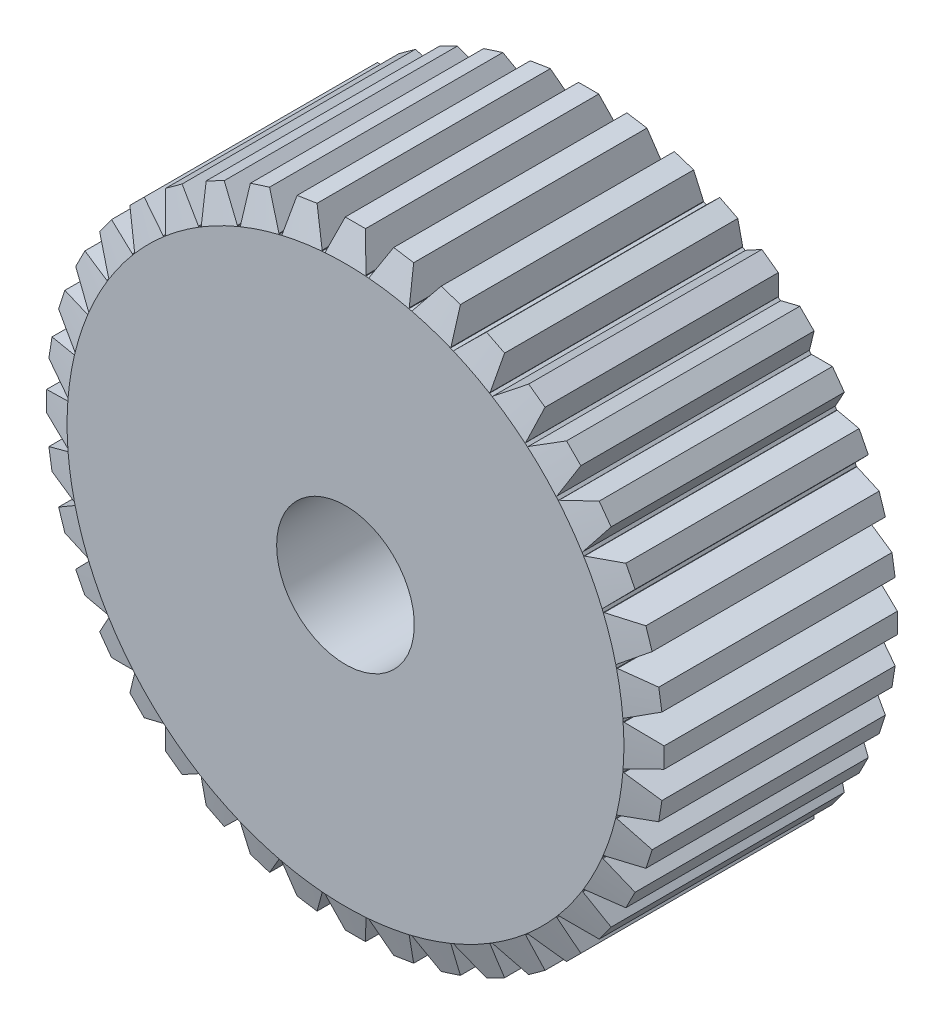
from build123d import *

# Parameters (mm, degrees)
SKETCH1_R             = 6.985
BOSS_EXTRUDE1_DEPTH   = 6.35
BOSS_EXTRUDE4_DEPTH   = 6.35
CIRPATTERN2_COUNT     = 40
SKETCH5_R             = 4.318
CUT_EXTRUDE1_DEPTH    = 1.778
F_8_32_TAPPED_HOLE1_D = 3.4544


with BuildPart() as part:
    # Sketch1 → Boss-Extrude1 (new body)
    with BuildSketch(Plane.XY):
        Circle(SKETCH1_R)
    extrude(amount=-BOSS_EXTRUDE1_DEPTH)


with BuildPart() as body_2:
    # Sketch2 → Boss-Extrude4 (new, through all)
    with BuildSketch(Plane.XY):
        Polygon((-0.508, 6.985), (-0.254, 7.747), (0, 7.747), (0.254, 7.747), (0.508, 6.985), (0.508, 6.731), (-0.508, 6.731), align=None)
    extrude(amount=-BOSS_EXTRUDE4_DEPTH)


with BuildPart() as cirpattern2_1:
    # CirPattern2: pattern copy
    add(body_2.part.rotate(Axis((0, 0, 0), (0, 0, 1)), 1 * 360 / CIRPATTERN2_COUNT))


with BuildPart() as cirpattern2_2:
    # CirPattern2: pattern copy
    add(body_2.part.rotate(Axis((0, 0, 0), (0, 0, 1)), 2 * 360 / CIRPATTERN2_COUNT))


with BuildPart() as cirpattern2_3:
    # CirPattern2: pattern copy
    add(body_2.part.rotate(Axis((0, 0, 0), (0, 0, 1)), 3 * 360 / CIRPATTERN2_COUNT))


with BuildPart() as cirpattern2_4:
    # CirPattern2: pattern copy
    add(body_2.part.rotate(Axis((0, 0, 0), (0, 0, 1)), 4 * 360 / CIRPATTERN2_COUNT))


with BuildPart() as cirpattern2_5:
    # CirPattern2: pattern copy
    add(body_2.part.rotate(Axis((0, 0, 0), (0, 0, 1)), 5 * 360 / CIRPATTERN2_COUNT))


with BuildPart() as cirpattern2_6:
    # CirPattern2: pattern copy
    add(body_2.part.rotate(Axis((0, 0, 0), (0, 0, 1)), 6 * 360 / CIRPATTERN2_COUNT))


with BuildPart() as cirpattern2_7:
    # CirPattern2: pattern copy
    add(body_2.part.rotate(Axis((0, 0, 0), (0, 0, 1)), 7 * 360 / CIRPATTERN2_COUNT))


with BuildPart() as cirpattern2_8:
    # CirPattern2: pattern copy
    add(body_2.part.rotate(Axis((0, 0, 0), (0, 0, 1)), 8 * 360 / CIRPATTERN2_COUNT))


with BuildPart() as cirpattern2_9:
    # CirPattern2: pattern copy
    add(body_2.part.rotate(Axis((0, 0, 0), (0, 0, 1)), 9 * 360 / CIRPATTERN2_COUNT))


with BuildPart() as cirpattern2_10:
    # CirPattern2: pattern copy
    add(body_2.part.rotate(Axis((0, 0, 0), (0, 0, 1)), 10 * 360 / CIRPATTERN2_COUNT))


with BuildPart() as cirpattern2_11:
    # CirPattern2: pattern copy
    add(body_2.part.rotate(Axis((0, 0, 0), (0, 0, 1)), 11 * 360 / CIRPATTERN2_COUNT))


with BuildPart() as cirpattern2_12:
    # CirPattern2: pattern copy
    add(body_2.part.rotate(Axis((0, 0, 0), (0, 0, 1)), 12 * 360 / CIRPATTERN2_COUNT))


with BuildPart() as cirpattern2_13:
    # CirPattern2: pattern copy
    add(body_2.part.rotate(Axis((0, 0, 0), (0, 0, 1)), 13 * 360 / CIRPATTERN2_COUNT))


with BuildPart() as cirpattern2_14:
    # CirPattern2: pattern copy
    add(body_2.part.rotate(Axis((0, 0, 0), (0, 0, 1)), 14 * 360 / CIRPATTERN2_COUNT))


with BuildPart() as cirpattern2_15:
    # CirPattern2: pattern copy
    add(body_2.part.rotate(Axis((0, 0, 0), (0, 0, 1)), 15 * 360 / CIRPATTERN2_COUNT))


with BuildPart() as cirpattern2_16:
    # CirPattern2: pattern copy
    add(body_2.part.rotate(Axis((0, 0, 0), (0, 0, 1)), 16 * 360 / CIRPATTERN2_COUNT))


with BuildPart() as cirpattern2_17:
    # CirPattern2: pattern copy
    add(body_2.part.rotate(Axis((0, 0, 0), (0, 0, 1)), 17 * 360 / CIRPATTERN2_COUNT))


with BuildPart() as cirpattern2_18:
    # CirPattern2: pattern copy
    add(body_2.part.rotate(Axis((0, 0, 0), (0, 0, 1)), 18 * 360 / CIRPATTERN2_COUNT))


with BuildPart() as cirpattern2_19:
    # CirPattern2: pattern copy
    add(body_2.part.rotate(Axis((0, 0, 0), (0, 0, 1)), 19 * 360 / CIRPATTERN2_COUNT))


with BuildPart() as cirpattern2_20:
    # CirPattern2: pattern copy
    add(body_2.part.rotate(Axis((0, 0, 0), (0, 0, 1)), 20 * 360 / CIRPATTERN2_COUNT))


with BuildPart() as cirpattern2_21:
    # CirPattern2: pattern copy
    add(body_2.part.rotate(Axis((0, 0, 0), (0, 0, 1)), 21 * 360 / CIRPATTERN2_COUNT))


with BuildPart() as cirpattern2_22:
    # CirPattern2: pattern copy
    add(body_2.part.rotate(Axis((0, 0, 0), (0, 0, 1)), 22 * 360 / CIRPATTERN2_COUNT))


with BuildPart() as cirpattern2_23:
    # CirPattern2: pattern copy
    add(body_2.part.rotate(Axis((0, 0, 0), (0, 0, 1)), 23 * 360 / CIRPATTERN2_COUNT))


with BuildPart() as cirpattern2_24:
    # CirPattern2: pattern copy
    add(body_2.part.rotate(Axis((0, 0, 0), (0, 0, 1)), 24 * 360 / CIRPATTERN2_COUNT))


with BuildPart() as cirpattern2_25:
    # CirPattern2: pattern copy
    add(body_2.part.rotate(Axis((0, 0, 0), (0, 0, 1)), 25 * 360 / CIRPATTERN2_COUNT))


with BuildPart() as cirpattern2_26:
    # CirPattern2: pattern copy
    add(body_2.part.rotate(Axis((0, 0, 0), (0, 0, 1)), 26 * 360 / CIRPATTERN2_COUNT))


with BuildPart() as cirpattern2_27:
    # CirPattern2: pattern copy
    add(body_2.part.rotate(Axis((0, 0, 0), (0, 0, 1)), 27 * 360 / CIRPATTERN2_COUNT))


with BuildPart() as cirpattern2_28:
    # CirPattern2: pattern copy
    add(body_2.part.rotate(Axis((0, 0, 0), (0, 0, 1)), 28 * 360 / CIRPATTERN2_COUNT))


with BuildPart() as cirpattern2_29:
    # CirPattern2: pattern copy
    add(body_2.part.rotate(Axis((0, 0, 0), (0, 0, 1)), 29 * 360 / CIRPATTERN2_COUNT))


with BuildPart() as cirpattern2_30:
    # CirPattern2: pattern copy
    add(body_2.part.rotate(Axis((0, 0, 0), (0, 0, 1)), 30 * 360 / CIRPATTERN2_COUNT))


with BuildPart() as cirpattern2_31:
    # CirPattern2: pattern copy
    add(body_2.part.rotate(Axis((0, 0, 0), (0, 0, 1)), 31 * 360 / CIRPATTERN2_COUNT))


with BuildPart() as cirpattern2_32:
    # CirPattern2: pattern copy
    add(body_2.part.rotate(Axis((0, 0, 0), (0, 0, 1)), 32 * 360 / CIRPATTERN2_COUNT))


with BuildPart() as cirpattern2_33:
    # CirPattern2: pattern copy
    add(body_2.part.rotate(Axis((0, 0, 0), (0, 0, 1)), 33 * 360 / CIRPATTERN2_COUNT))


with BuildPart() as cirpattern2_34:
    # CirPattern2: pattern copy
    add(body_2.part.rotate(Axis((0, 0, 0), (0, 0, 1)), 34 * 360 / CIRPATTERN2_COUNT))


with BuildPart() as cirpattern2_35:
    # CirPattern2: pattern copy
    add(body_2.part.rotate(Axis((0, 0, 0), (0, 0, 1)), 35 * 360 / CIRPATTERN2_COUNT))


with BuildPart() as cirpattern2_36:
    # CirPattern2: pattern copy
    add(body_2.part.rotate(Axis((0, 0, 0), (0, 0, 1)), 36 * 360 / CIRPATTERN2_COUNT))


with BuildPart() as cirpattern2_37:
    # CirPattern2: pattern copy
    add(body_2.part.rotate(Axis((0, 0, 0), (0, 0, 1)), 37 * 360 / CIRPATTERN2_COUNT))


with BuildPart() as cirpattern2_38:
    # CirPattern2: pattern copy
    add(body_2.part.rotate(Axis((0, 0, 0), (0, 0, 1)), 38 * 360 / CIRPATTERN2_COUNT))


with BuildPart() as cirpattern2_39:
    # CirPattern2: pattern copy
    add(body_2.part.rotate(Axis((0, 0, 0), (0, 0, 1)), 39 * 360 / CIRPATTERN2_COUNT))


with BuildPart() as part_1:
    add(part.part)

    # Combine2: union body 2, CirPattern2_1, CirPattern2_2, CirPattern2_3, CirPattern2_4, CirPattern2_5, CirPattern2_6, CirPattern2_7, CirPattern2_8, CirPattern2_9, CirPattern2_10, CirPattern2_11, CirPattern2_12, CirPattern2_13, CirPattern2_14, CirPattern2_15, CirPattern2_16, CirPattern2_17, CirPattern2_18, CirPattern2_19, CirPattern2_20, CirPattern2_21, CirPattern2_22, CirPattern2_23, CirPattern2_24, CirPattern2_25, CirPattern2_26, CirPattern2_27, CirPattern2_28, CirPattern2_29, CirPattern2_30, CirPattern2_31, CirPattern2_32, CirPattern2_33, CirPattern2_34, CirPattern2_35, CirPattern2_36, CirPattern2_37, CirPattern2_38, CirPattern2_39
    add(body_2.part)
    add(cirpattern2_1.part)
    add(cirpattern2_2.part)
    add(cirpattern2_3.part)
    add(cirpattern2_4.part)
    add(cirpattern2_5.part)
    add(cirpattern2_6.part)
    add(cirpattern2_7.part)
    add(cirpattern2_8.part)
    add(cirpattern2_9.part)
    add(cirpattern2_10.part)
    add(cirpattern2_11.part)
    add(cirpattern2_12.part)
    add(cirpattern2_13.part)
    add(cirpattern2_14.part)
    add(cirpattern2_15.part)
    add(cirpattern2_16.part)
    add(cirpattern2_17.part)
    add(cirpattern2_18.part)
    add(cirpattern2_19.part)
    add(cirpattern2_20.part)
    add(cirpattern2_21.part)
    add(cirpattern2_22.part)
    add(cirpattern2_23.part)
    add(cirpattern2_24.part)
    add(cirpattern2_25.part)
    add(cirpattern2_26.part)
    add(cirpattern2_27.part)
    add(cirpattern2_28.part)
    add(cirpattern2_29.part)
    add(cirpattern2_30.part)
    add(cirpattern2_31.part)
    add(cirpattern2_32.part)
    add(cirpattern2_33.part)
    add(cirpattern2_34.part)
    add(cirpattern2_35.part)
    add(cirpattern2_36.part)
    add(cirpattern2_37.part)
    add(cirpattern2_38.part)
    add(cirpattern2_39.part)

    # Sketch5 → Cut-Extrude1 (cut)
    with BuildSketch(Plane(origin=(0, 0, -6.35), x_dir=(-1, 0, 0), z_dir=(0, 0, -1))):
        Circle(SKETCH5_R)
    extrude(amount=-CUT_EXTRUDE1_DEPTH, mode=Mode.SUBTRACT)

    # Sketch4 → Cut-Revolve3 (revolve, cut)
    with BuildSketch(Plane(origin=(0, 0, 0), x_dir=(0, 0, -1), z_dir=(1, 0, 0))):
        Polygon((6.096, 7.766731618), (6.096, 8.001), (6.4008, 8.001), (6.4008, 6.985), (6.35, 6.985), align=None)
    cut_revolve3 = revolve(axis=Axis((0, 0, 0), (0, 0, -1)), mode=Mode.SUBTRACT)

    # Mirror1: Cut-Revolve3 across plane
    add(cut_revolve3.mirror(Plane.XY.offset(-3.175)), mode=Mode.SUBTRACT)

    # #8-32 Tapped Hole1 (through all)
    with Locations(Plane(origin=(0, 0, -4.572), x_dir=(-1, 0, 0), z_dir=(0, 0, -1))):
        with Locations((0, 0)):
            Hole(F_8_32_TAPPED_HOLE1_D / 2)


solid = part_1.part
